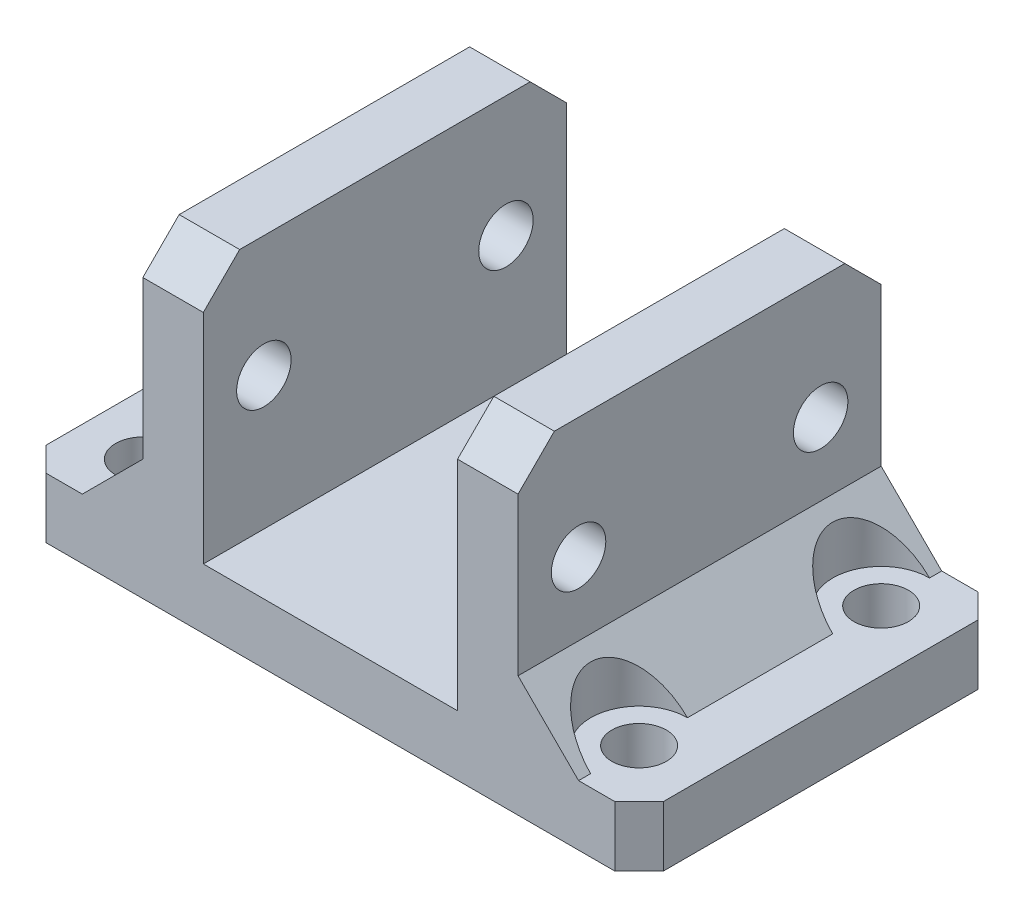
from build123d import *

# Parameters (mm, degrees)
BOSS_EXTRUDE1_DEPTH = 30
SKETCH15_R          = 2.25
CUT_EXTRUDE1_DEPTH  = 31
SKETCH14_R          = 2.25
CUT_EXTRUDE2_DEPTH  = 5
CHAMFER2_SIZE       = 3
CHAMFER3_SIZE       = 2
CHAMFER4_SIZE       = 5
SKETCH14_7_R        = 4
CUT_EXTRUDE3_DEPTH  = 10


with BuildPart() as part:
    # Sketch13 → Boss-Extrude1 (new body)
    with BuildSketch(Plane.XY):
        Polygon((-26, -15.975764912), (-26, -11), (-16, -11), (-16, 10), (-11, 10), (-11, -11), (10, -11), (10, 10), (15, 10), (15, -11), (25, -11), (25, -15.975764912), align=None)
    extrude(amount=-BOSS_EXTRUDE1_DEPTH)

    # Sketch15 → Cut-Extrude1 (cut)
    with BuildSketch(Plane(origin=(15, 0, 0), x_dir=(0, 0, -1), z_dir=(1, 0, 0))):
        with Locations((5, 0)):
            Circle(SKETCH15_R)
        with Locations((25, 0)):
            Circle(SKETCH15_R)
    extrude(amount=-CUT_EXTRUDE1_DEPTH, mode=Mode.SUBTRACT)

    # Sketch14 → Cut-Extrude2 (cut)
    with BuildSketch(Plane(origin=(0, -11, 0), x_dir=(1, 0, 0), z_dir=(0, 1, 0))):
        with Locations(Location((20, 25, 0), (0, 0, 180))):
            Circle(SKETCH14_R)
        with Locations(Location((20, 5, 0), (0, 0, 180))):
            Circle(SKETCH14_R)
        with Locations(Location((-21, 5, 0), (0, 0, 180))):
            Circle(SKETCH14_R)
        with Locations(Location((-21, 25, 0), (0, 0, 180))):
            Circle(SKETCH14_R)
    extrude(amount=-CUT_EXTRUDE2_DEPTH, mode=Mode.SUBTRACT)

    # Chamfer2
    chamfer2_edges = [part.edges().sort_by_distance(p)[0] for p in [
        (-13.5, 10, 0),
        (12.5, 10, 0),
        (12.5, 10, -30),
        (-13.5, 10, -30),
    ]]
    chamfer(chamfer2_edges, length=CHAMFER2_SIZE)

    # Chamfer3
    chamfer3_edges = [part.edges().sort_by_distance(p)[0] for p in [
        (25, -13.487882456, -30),
        (25, -13.487882456, 0),
        (-26, -13.487882456, 0),
        (-26, -13.487882456, -30),
    ]]
    chamfer(chamfer3_edges, length=CHAMFER3_SIZE)

    # Chamfer4
    # the kernel refuses this chamfer: 5 mm, written as the material it adds along each edge
    with BuildSketch(Plane(origin=(-16, -11, 0), x_dir=(-0.9996219169112968, -0.027495876610586317, 0), z_dir=(0, 0, -1))) as chamfer4_piece_1_section:
        Polygon((CHAMFER4_SIZE * 0.999621916911, CHAMFER4_SIZE * 0.0274958766106), (-CHAMFER4_SIZE * 0.0274958766106, CHAMFER4_SIZE * 0.999621916911), (0, 0), align=None)
    chamfer4_piece_1 = extrude(amount=30, mode=Mode.PRIVATE)
    chamfer4_piece_1 = chamfer4_piece_1 - Plane(origin=(-21, -9.300389261, -25), x_dir=(-1, 0, 0), z_dir=(0, 1, 0)) * Cylinder(2.25, 80, mode=Mode.PRIVATE)
    chamfer4_piece_1 = chamfer4_piece_1 - Plane(origin=(-21, -9.300389261, -5), x_dir=(-1, 0, 0), z_dir=(0, 1, 0)) * Cylinder(2.25, 80, mode=Mode.PRIVATE)
    add(chamfer4_piece_1)
    with BuildSketch(Plane(origin=(15, -11, 0), x_dir=(0.9996219169112968, -0.027495876610586337, 0), z_dir=(0, 0, -1))) as chamfer4_piece_2_section:
        Polygon((CHAMFER4_SIZE * 0.999621916911, -CHAMFER4_SIZE * 0.0274958766106), (-CHAMFER4_SIZE * 0.0274958766106, -CHAMFER4_SIZE * 0.999621916911), (0, 0), align=None)
    chamfer4_piece_2 = extrude(amount=30, mode=Mode.PRIVATE)
    chamfer4_piece_2 = chamfer4_piece_2 - Plane(origin=(20, -9.300389689, -25), x_dir=(-1, 0, 0), z_dir=(0, 1, 0)) * Cylinder(2.25, 80, mode=Mode.PRIVATE)
    chamfer4_piece_2 = chamfer4_piece_2 - Plane(origin=(20, -9.300389689, -5), x_dir=(-1, 0, 0), z_dir=(0, 1, 0)) * Cylinder(2.25, 80, mode=Mode.PRIVATE)
    add(chamfer4_piece_2)

    # Sketch14<7> → Cut-Extrude3 (cut)
    with BuildSketch(Plane(origin=(0, -11, 0), x_dir=(1, 0, 0), z_dir=(0, 1, 0))):
        with Locations((20, 25)):
            Circle(SKETCH14_7_R)
        with Locations((20, 5)):
            Circle(SKETCH14_7_R)
        with Locations((-21, 5)):
            Circle(SKETCH14_7_R)
        with Locations((-21, 25)):
            Circle(SKETCH14_7_R)
    extrude(amount=CUT_EXTRUDE3_DEPTH, mode=Mode.SUBTRACT)


solid = part.part
